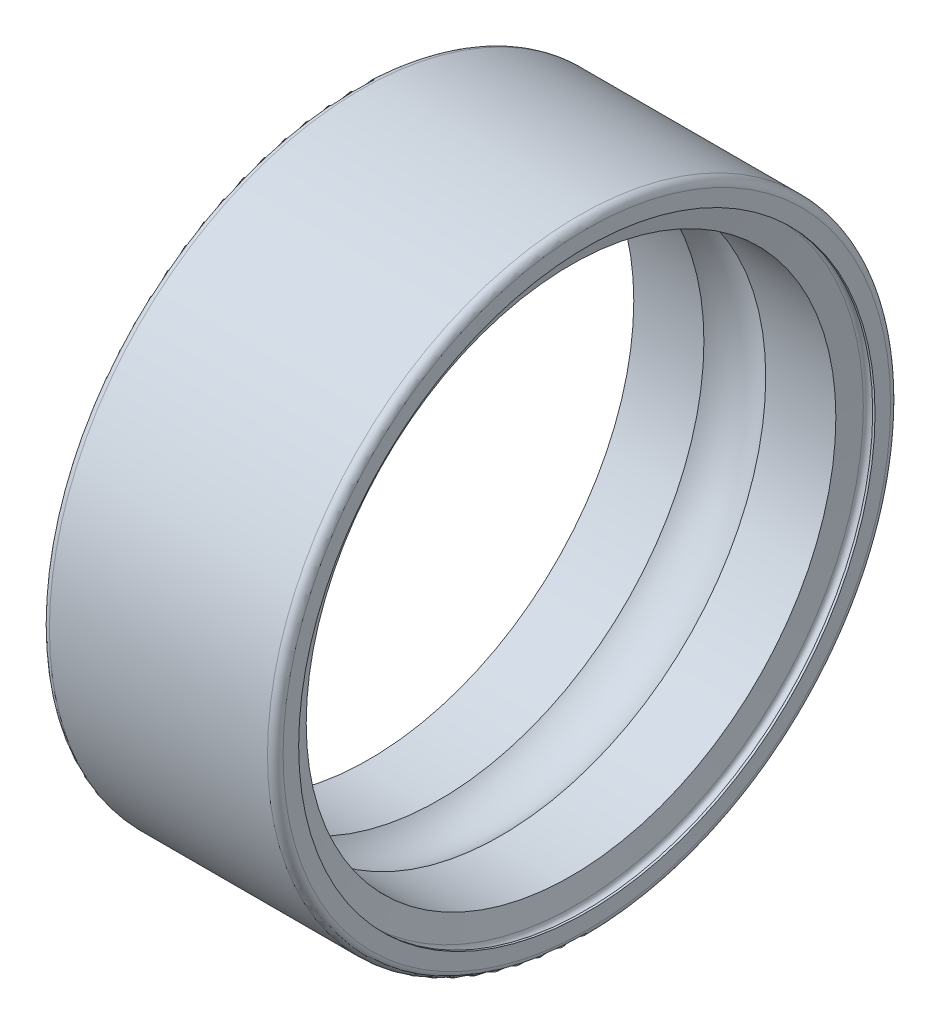
from build123d import *


with BuildPart() as part:
    # Sketch1 → Revolve1 (revolve)
    with BuildSketch(Plane.XY):
        with BuildLine():
            Line((0, 3.9), (0, 3.7))
            Line((0, 3.7), (0.03, 3.7))
            ThreePointArc((0.03, 3.7), (0.09, 3.76), (0.15, 3.7))
            Line((0.15, 3.7), (0.202898094, 3.4))
            Line((0.202898094, 3.4), (1.103137303, 3.4))
            ThreePointArc((1.103137303, 3.4), (1.5, 3.55), (1.896862697, 3.4))
            Line((1.896862697, 3.4), (2.797101906, 3.4))
            Line((2.797101906, 3.4), (2.85, 3.7))
            ThreePointArc((2.85, 3.7), (2.91, 3.76), (2.97, 3.7))
            Line((2.97, 3.7), (3, 3.7))
            Line((3, 3.7), (3, 3.9))
            ThreePointArc((3, 3.9), (2.970710678, 3.970710678), (2.9, 4))
            Line((2.9, 4), (0.1, 4))
            ThreePointArc((0.1, 4), (0.029289322, 3.970710678), (0, 3.9))
        make_face()
    revolve(axis=Axis((50, 0, 0), (-1, 0, 0)))


solid = part.part
